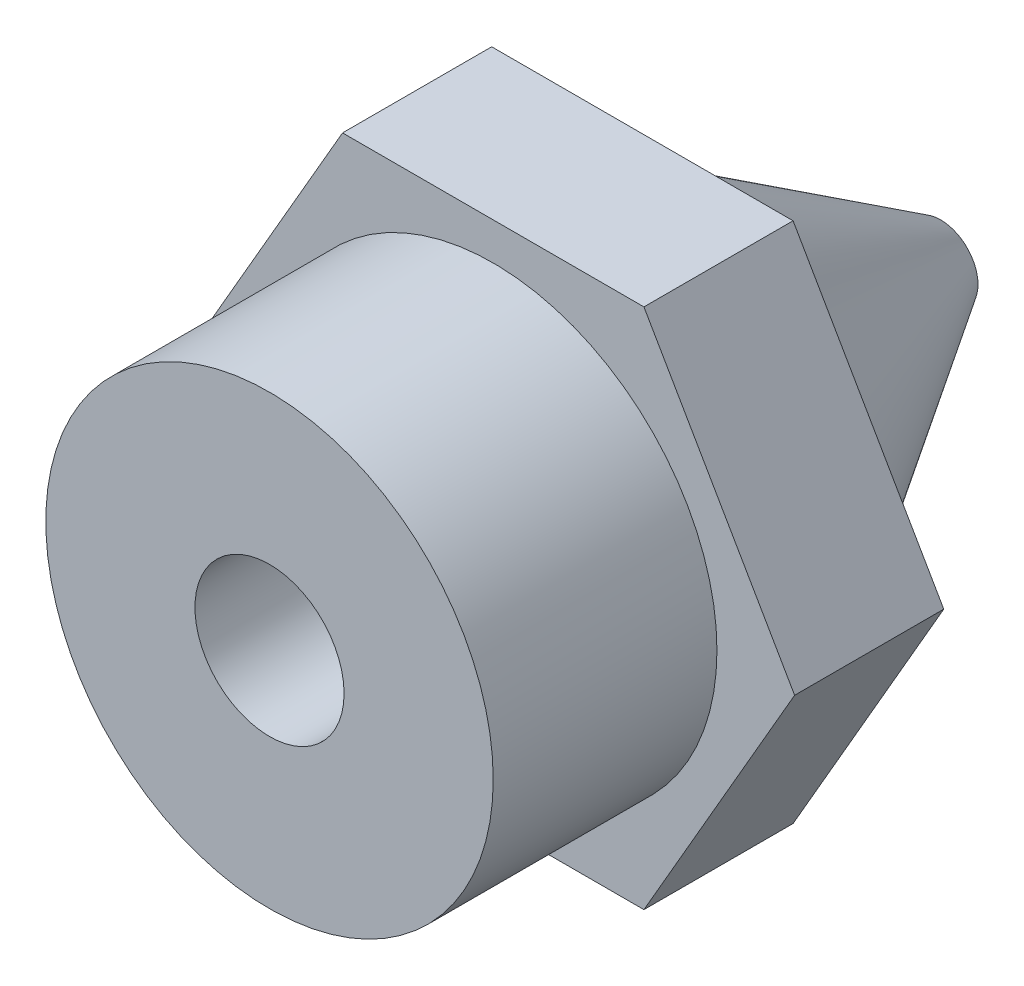
from build123d import *

# Parameters (mm, degrees)
BOSS_EXTRU_1_DEPTH      = 9
ESQUISSE2_W             = 19.623971562
ESQUISSE2_H             = 15.534154535
ESQUISSE2_R             = 3
ENL_V_MAT_EXTRU_1_DEPTH = 3
ENL_V_START             = -4
ESQUISSE3_W             = 11.267201257
ESQUISSE3_H             = 13.961169169
ESQUISSE3_R             = 3
ENL_V_MAT_EXTRU_2_DEPTH = 4
CHANFREIN1_SIZE         = 4
CHANFREIN1_SIZE_2       = 2.499477408


with BuildPart() as part:
    # Esquisse1 → Boss.-Extru.1 (new body)
    with BuildSketch(Plane.XY):
        Polygon((4.041451884, 0), (2.020725942, 3.5), (-2.020725942, 3.5), (-4.041451884, 0), (-2.020725942, -3.5), (2.020725942, -3.5), align=None)
    extrude(amount=BOSS_EXTRU_1_DEPTH)

    # Esquisse2 → Enlèv. mat.-Extru.1 (cut)
    with BuildSketch(Plane.XY.offset(9)):
        with Locations((0.327116653, -1.544441398)):
            Rectangle(ESQUISSE2_W, ESQUISSE2_H)
        Circle(ESQUISSE2_R, mode=Mode.SUBTRACT)
    extrude(amount=-ENL_V_MAT_EXTRU_1_DEPTH, mode=Mode.SUBTRACT)

    # Esquisse3 → Enlèv. mat.-Extru.2 (cut)
    with BuildSketch(Plane(origin=(0, 0, 0), x_dir=(-1, 0, 0), z_dir=(0, 0, -1)).offset(ENL_V_START)):
        with Locations((0.009770186, 0.039262349)):
            Rectangle(ESQUISSE3_W, ESQUISSE3_H)
        with Locations(Location((0, 0, 0), (0, 0, 180))):
            Circle(ESQUISSE3_R, mode=Mode.SUBTRACT)
    extrude(amount=ENL_V_MAT_EXTRU_2_DEPTH, mode=Mode.SUBTRACT)

    # Chanfrein1
    # the kernel refuses this chamfer: 4, 2.499477408 mm, written as the material it takes off along each edge
    with BuildSketch(Plane(origin=(0, 0, 0), x_dir=(1, 0, 0), z_dir=(0, 1, 0))) as chanfrein1_piece_1_section:
        Polygon((3, -CHANFREIN1_SIZE), (3 - CHANFREIN1_SIZE_2, 0), (3, 0), align=None)
    chanfrein1_piece_1 = revolve(axis=Axis((0, 0, 0), (0, 0, -1)), mode=Mode.PRIVATE)
    chanfrein1_piece_1 = split(chanfrein1_piece_1, bisect_by=Plane(origin=(-1.744026904, 0, 4), z_dir=(0, 0, -1)), keep=Keep.TOP, mode=Mode.PRIVATE)
    add(chanfrein1_piece_1, mode=Mode.SUBTRACT)

    # Esquisse4 → Enlèvement de matière-Révolution1 (revolve, cut)
    with BuildSketch(Plane(origin=(0, 0, 0), x_dir=(1, 0, 0), z_dir=(0, 1, 0))):
        Polygon((0, -9), (1, -9), (1, -5.7010425), (0.3, 0), (0, 0), align=None)
    revolve(axis=Axis((0, 0, 10.381605157), (0, 0, -1)), mode=Mode.SUBTRACT)


solid = part.part
